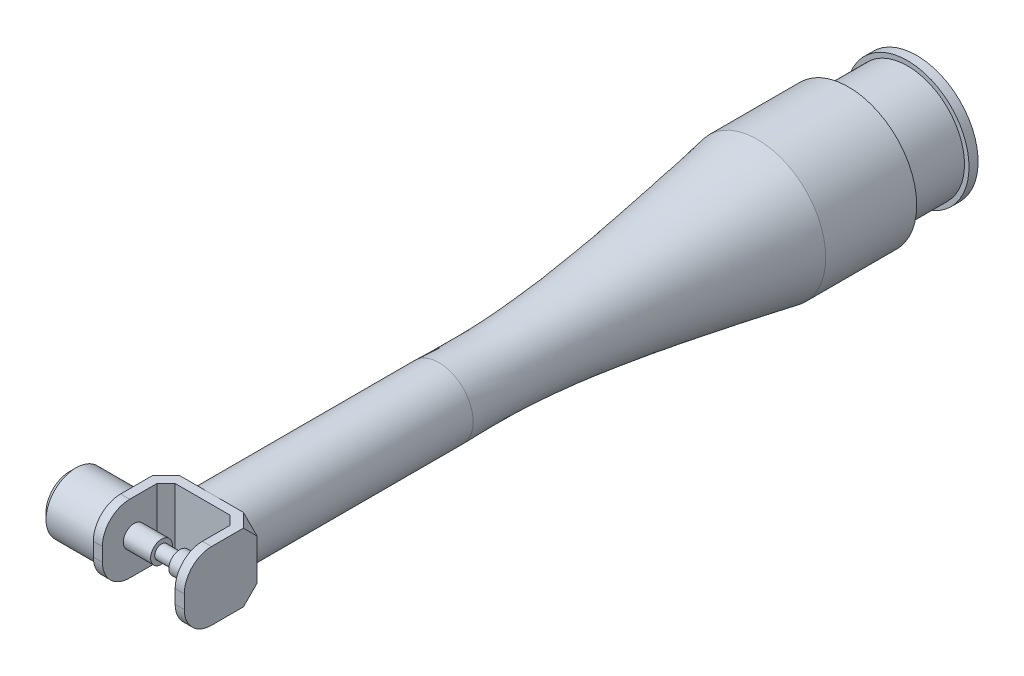
from build123d import *

# Parameters (mm, degrees)
SKETCH1_R           = 75
BOSS_EXTRUDE1_DEPTH = 100
SKETCH3_R           = 37.5
BOSS_EXTRUDE2_DEPTH = 250
SKETCH4_R           = 62.5
BOSS_EXTRUDE3_DEPTH = 75
SKETCH5_W           = 50
SKETCH5_H           = 75
BOSS_EXTRUDE4_DEPTH = 10
SKETCH6_W           = 10
SKETCH6_H           = 75
BOSS_EXTRUDE5_DEPTH = 70
SKETCH7_R           = 7.5
BOSS_EXTRUDE6_DEPTH = 40
BOSS_EXTRUDE7_START = 61
SKETCH8_R           = 32.966655639
SKETCH8_R_2         = 7.5
BOSS_EXTRUDE7_DEPTH = 61
CHAMFER2_SIZE       = 7
BOSS_EXTRUDE8_START = 30
SKETCH9_R           = 12
SKETCH9_R_2         = 7.5
BOSS_EXTRUDE8_DEPTH = 30
FILLET1_R           = 30
CHAMFER4_SIZE       = 10
CHAMFER5_START      = 353
CHAMFER5_OUTLINE_W  = 21
CHAMFER5_OUTLINE_H  = 25
CHAMFER5_DEPTH      = 9.287293916
CHAMFER6_START      = 353
CHAMFER6_OUTLINE_W  = 21
CHAMFER6_OUTLINE_H  = 25
CHAMFER6_DEPTH      = 9.287293916
CHAMFER7_START      = -362.287293916
CHAMFER7_OUTLINE_W  = 21
CHAMFER7_OUTLINE_H  = 25
CHAMFER7_DEPTH      = 9.287293916
CHAMFER8_START      = -362.287293916
CHAMFER8_OUTLINE_W  = 21
CHAMFER8_OUTLINE_H  = 25
CHAMFER8_DEPTH      = 9.287293916
SKETCH10_R          = 67.5
BOSS_EXTRUDE9_DEPTH = 10


with BuildPart() as part:
    # Sketch1 → Boss-Extrude1 (new body)
    with BuildSketch(Plane.XY):
        Circle(SKETCH1_R)
    extrude(amount=BOSS_EXTRUDE1_DEPTH)

    # Loft1: read off the stored shape, not the designer's step
    # Loft1: loft between two sections, ruled curve by curve
    loft1_from = [
        Edge.make_bspline([(55.013686164, 50.975428734, 100), (-46.937171304, 161.002801063, 100), (-156.964543632, 59.051943595, 100), (-55.013686164, -50.975428734, 100), (46.937171304, -161.002801063, 100), (156.964543632, -59.051943595, 100), (55.013686164, 50.975428734, 100)], [0, 0, 0, 0, 0.5, 0.5, 0.5, 1, 1, 1, 1], 3, [1, 0.333333333, 0.333333333, 1, 0.333333333, 0.333333333, 1]),
    ]
    loft1_to = [
        Edge.make_bspline([(-15.510833372, 34.141822566, 450), (-83.794478503, 3.120155821, 450), (-52.772811759, -65.16348931, 450), (15.510833372, -34.141822566, 450), (83.794478503, -3.120155821, 450), (52.772811759, 65.16348931, 450), (-15.510833372, 34.141822566, 450)], [0, 0, 0, 0, 0.5, 0.5, 0.5, 1, 1, 1, 1], 3, [1, 0.333333333, 0.333333333, 1, 0.333333333, 0.333333333, 1]),
    ]
    loft1 = Solid(Shell([*[Face.make_surface_from_curves(loft1_from[k], loft1_to[k]) for k in range(1)], Face(Wire(loft1_from)), Face(Wire(loft1_to))]))
    add(loft1)

    # Sketch3 → Boss-Extrude2 (add)
    with BuildSketch(Plane.XY.offset(450)):
        with Locations(Location((0, 0, 0), (0, 0, 114.432581244))):
            Circle(SKETCH3_R)
    extrude(amount=BOSS_EXTRUDE2_DEPTH)

    # Sketch4 → Boss-Extrude3 (add)
    with BuildSketch(Plane(origin=(0, 0, 0), x_dir=(-1, 0, 0), z_dir=(0, 0, -1))):
        Circle(SKETCH4_R)
    extrude(amount=BOSS_EXTRUDE3_DEPTH)

    # Sketch5 → Boss-Extrude4 (add)
    with BuildSketch(Plane.XY.offset(700)):
        with Locations((-25, 0)):
            Rectangle(SKETCH5_W, SKETCH5_H)
    boss_extrude4 = extrude(amount=BOSS_EXTRUDE4_DEPTH)

    # Sketch6 → Boss-Extrude5 (add)
    with BuildSketch(Plane.XY.offset(710)):
        with Locations((-45, 0)):
            Rectangle(SKETCH6_W, SKETCH6_H)
    boss_extrude5 = extrude(amount=BOSS_EXTRUDE5_DEPTH)

    # Sketch7 → Boss-Extrude6 (add)
    with BuildSketch(Plane(origin=(-40, 0, 0), x_dir=(0, 0, -1), z_dir=(1, 0, 0))):
        with Locations(Location((-745, 0, 0), (0, 0, 270))):
            Circle(SKETCH7_R)
    boss_extrude6 = extrude(amount=BOSS_EXTRUDE6_DEPTH)

    # Mirror1: Boss-Extrude4, Boss-Extrude5, Boss-Extrude6 across plane
    add(boss_extrude4.mirror(Plane(origin=(0, 0, 710), x_dir=(0, 0, 1), z_dir=(-1, 0, 0))))
    add(boss_extrude5.mirror(Plane(origin=(0, 0, 710), x_dir=(0, 0, 1), z_dir=(-1, 0, 0))))
    add(boss_extrude6.mirror(Plane(origin=(0, 0, 710), x_dir=(0, 0, 1), z_dir=(-1, 0, 0))))

    # Sketch8 → Boss-Extrude7 (add)
    # profile 1 of 2: a face of its own
    with BuildSketch(Plane.ZY.offset(50).offset(BOSS_EXTRUDE7_START)):
        with Locations(Location((745, 0, 0), (0, 0, 180))):
            Circle(SKETCH8_R)
        with Locations(Location((745, 0, 0), (0, 0, 270))):
            Circle(SKETCH8_R_2, mode=Mode.SUBTRACT)
    # profile 2 of 2: a face of its own
    with BuildSketch(Plane.ZY.offset(50).offset(BOSS_EXTRUDE7_START)):
        with Locations(Location((745, 0, 0), (0, 0, 270))):
            Circle(SKETCH8_R_2)
    extrude(amount=-BOSS_EXTRUDE7_DEPTH)

    # Chamfer2
    chamfer2_edges = [part.edges().sort_by_distance(p)[0] for p in [
        (-111, 0, 777.966655639),
    ]]
    chamfer(chamfer2_edges, length=CHAMFER2_SIZE)

    # Sketch9 → Boss-Extrude8 (add)
    with BuildSketch(Plane.ZY.offset(-40).offset(BOSS_EXTRUDE8_START)):
        with Locations(Location((745, 0, 0), (0, 0, 270))):
            Circle(SKETCH9_R)
        with Locations(Location((745, 0, 0), (0, 0, 270))):
            Circle(SKETCH9_R_2, mode=Mode.SUBTRACT)
    boss_extrude8 = extrude(amount=-BOSS_EXTRUDE8_DEPTH)

    # Mirror2: Boss-Extrude8 across plane
    add(boss_extrude8.mirror(Plane(origin=(0, 0, 0), x_dir=(0, 0, 1), z_dir=(1, 0, 0))))

    # Fillet1
    fillet1_edges = [part.edges().sort_by_distance(p)[0] for p in [
        (-45, -37.5, 780),
        (-45, 37.5, 780),
        (45, 37.5, 780),
        (45, -37.5, 780),
    ]]
    fillet(fillet1_edges, radius=FILLET1_R)

    # Chamfer4
    chamfer4_edges = [part.edges().sort_by_distance(p)[0] for p in [
        (-40, 0, 710),
        (40, 0, 710),
    ]]
    chamfer(chamfer4_edges, length=CHAMFER4_SIZE)

    # Chamfer5: read off the stored shape, not the designer's step
    # Chamfer5 outline → Chamfer5 (cut)
    with BuildSketch(Plane(origin=(0, 0, 0), x_dir=(0.8164965809277258, 0.40824829046386313, -0.40824829046386313), z_dir=(0.5773502691896258, -0.5773502691896258, 0.5773502691896258)).offset(CHAMFER5_START)):
        with Locations((-308.5, 521.5)):
            Rectangle(CHAMFER5_OUTLINE_W, CHAMFER5_OUTLINE_H)
    extrude(amount=CHAMFER5_DEPTH, mode=Mode.SUBTRACT)

    # Chamfer6: read off the stored shape, not the designer's step
    # Chamfer6 outline → Chamfer6 (cut)
    with BuildSketch(Plane(origin=(0, 0, 0), x_dir=(0.8164965809277258, -0.40824829046386313, -0.40824829046386313), z_dir=(0.5773502691896258, 0.5773502691896258, 0.5773502691896258)).offset(CHAMFER6_START)):
        with Locations((-308.5, -521.5)):
            Rectangle(CHAMFER6_OUTLINE_W, CHAMFER6_OUTLINE_H)
    extrude(amount=CHAMFER6_DEPTH, mode=Mode.SUBTRACT)

    # Chamfer7: read off the stored shape, not the designer's step
    # Chamfer7 outline → Chamfer7 (cut)
    with BuildSketch(Plane(origin=(0, 0, 0), x_dir=(0.8164965809277258, -0.40824829046386313, 0.40824829046386313), z_dir=(0.5773502691896258, 0.5773502691896258, -0.5773502691896258)).offset(CHAMFER7_START)):
        with Locations((308.5, -521.5)):
            Rectangle(CHAMFER7_OUTLINE_W, CHAMFER7_OUTLINE_H)
    extrude(amount=CHAMFER7_DEPTH, mode=Mode.SUBTRACT)

    # Chamfer8: read off the stored shape, not the designer's step
    # Chamfer8 outline → Chamfer8 (cut)
    with BuildSketch(Plane(origin=(0, 0, 0), x_dir=(0.8164965809277258, 0.40824829046386313, 0.40824829046386313), z_dir=(0.5773502691896258, -0.5773502691896258, -0.5773502691896258)).offset(CHAMFER8_START)):
        with Locations((308.5, 521.5)):
            Rectangle(CHAMFER8_OUTLINE_W, CHAMFER8_OUTLINE_H)
    extrude(amount=CHAMFER8_DEPTH, mode=Mode.SUBTRACT)

    # Sketch10 → Boss-Extrude9 (add)
    with BuildSketch(Plane(origin=(0, 0, -75), x_dir=(-1, 0, 0), z_dir=(0, 0, -1))):
        Circle(SKETCH10_R)
    extrude(amount=-BOSS_EXTRUDE9_DEPTH)


solid = part.part
